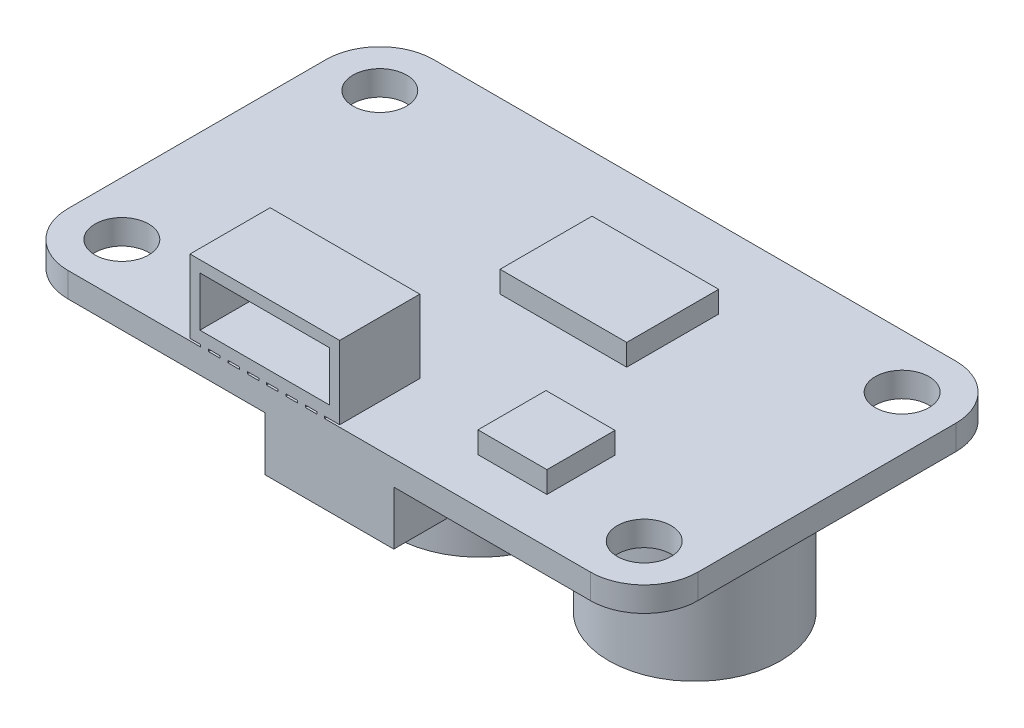
from build123d import *

# Parameters (mm, degrees)
SKETCH1_W           = 29.3
SKETCH1_H           = 17
SKETCH1_R           = 1.25
BOSS_EXTRUDE1_DEPTH = 1.15
FILLET1_R           = 2.5
SKETCH2_W           = 6.962283529
SKETCH2_H           = 3.729158124
BOSS_EXTRUDE2_DEPTH = 3.5
SKETCH3_W           = 0.499386372
SKETCH3_H           = 0.1
SKETCH3_W_2         = 0.535571303
SKETCH3_W_3         = 0.69846846
CUT_EXTRUDE1_DEPTH  = 5.5
SKETCH4_W           = 6.01860052
SKETCH4_H           = 2.306780687
CUT_EXTRUDE2_DEPTH  = 3.5
SKETCH5_W           = 5.89277612
SKETCH5_H           = 4.278029639
BOSS_EXTRUDE3_DEPTH = 1
SKETCH6_W           = 3.208522229
SKETCH6_H           = 3.166580762
BOSS_EXTRUDE4_DEPTH = 1
SKETCH7_W           = 6
SKETCH7_H           = 6
BOSS_EXTRUDE5_DEPTH = 3
SKETCH8_W           = 6
SKETCH8_H           = 6
SKETCH8_R           = 1.858011724
SKETCH8_R_2         = 0.603796911
CUT_EXTRUDE3_DEPTH  = 0.5
SKETCH10_R          = 4
BOSS_EXTRUDE6_DEPTH = 10
SKETCH11_R          = 2.5
CUT_EXTRUDE4_DEPTH  = 2
SKETCH12_R          = 2.5
SKETCH12_R_2        = 2.4
CUT_EXTRUDE5_DEPTH  = 2
FILLET2_R           = 2
SKETCH13_R          = 2.5
SKETCH13_R_2        = 2.4
CUT_EXTRUDE6_DEPTH  = 2
FILLET3_R           = 2
CHAMFER1_SIZE       = 0.5
SKETCH14_R          = 3.6
SKETCH14_R_2        = 3.5
CUT_EXTRUDE7_DEPTH  = 2


with BuildPart() as part:
    # Sketch1 → Boss-Extrude1 (new body)
    with BuildSketch(Plane(origin=(0, 0, 0), x_dir=(1, 0, 0), z_dir=(0, 1, 0))):
        Rectangle(SKETCH1_W, SKETCH1_H)
        with Locations(Location((-12.15, 6, 0), (0, 0, 270))):
            Circle(SKETCH1_R, mode=Mode.SUBTRACT)
        with Locations(Location((-12.15, -6, 0), (0, 0, 270))):
            Circle(SKETCH1_R, mode=Mode.SUBTRACT)
        with Locations(Location((12.15, -6, 0), (0, 0, 270))):
            Circle(SKETCH1_R, mode=Mode.SUBTRACT)
        with Locations(Location((12.15, 6, 0), (0, 0, 270))):
            Circle(SKETCH1_R, mode=Mode.SUBTRACT)
    extrude(amount=BOSS_EXTRUDE1_DEPTH)

    # Fillet1
    fillet1_edges = [part.edges().sort_by_distance(p)[0] for p in [
        (14.65, 0.575, 8.5),
        (-14.65, 0.575, 8.5),
        (-14.65, 0.575, -8.5),
        (14.65, 0.575, -8.5),
    ]]
    fillet(fillet1_edges, radius=FILLET1_R)

    # Sketch2 → Boss-Extrude2 (add)
    with BuildSketch(Plane(origin=(0, 1.15, 0), x_dir=(1, 0, 0), z_dir=(0, 1, 0))):
        with Locations((-2.998814894, -6.635420938)):
            Rectangle(SKETCH2_W, SKETCH2_H)
    extrude(amount=BOSS_EXTRUDE2_DEPTH)

    # Sketch3 → Cut-Extrude1 (cut)
    with BuildSketch(Plane.XY.offset(8.5)):
        with Locations((-6.230263472, 1.2)):
            Rectangle(SKETCH3_W, SKETCH3_H)
        with Locations((-5.348355938, 1.2)):
            Rectangle(SKETCH3_W_2, SKETCH3_H)
        with Locations((-4.448355938, 1.2)):
            Rectangle(SKETCH3_W_2, SKETCH3_H)
        with Locations((-3.548355938, 1.2)):
            Rectangle(SKETCH3_W_2, SKETCH3_H)
        with Locations((-2.648355937, 1.2)):
            Rectangle(SKETCH3_W_2, SKETCH3_H)
        with Locations((-1.748355937, 1.2)):
            Rectangle(SKETCH3_W_2, SKETCH3_H)
        with Locations((-0.848355938, 1.2)):
            Rectangle(SKETCH3_W_2, SKETCH3_H)
        with Locations((0.133092641, 1.2)):
            Rectangle(SKETCH3_W_3, SKETCH3_H)
    extrude(amount=-CUT_EXTRUDE1_DEPTH, mode=Mode.SUBTRACT)

    # Sketch4 → Cut-Extrude2 (cut)
    with BuildSketch(Plane.XY.offset(8.5)):
        with Locations((-3.00930026, 2.964607373)):
            Rectangle(SKETCH4_W, SKETCH4_H)
    extrude(amount=-CUT_EXTRUDE2_DEPTH, mode=Mode.SUBTRACT)

    # Sketch5 → Boss-Extrude3 (add)
    with BuildSketch(Plane(origin=(0, 1.15, 0), x_dir=(1, 0, 0), z_dir=(0, 1, 0))):
        with Locations((1.792997716, 2.736680725)):
            Rectangle(SKETCH5_W, SKETCH5_H)
    extrude(amount=BOSS_EXTRUDE3_DEPTH)

    # Sketch6 → Boss-Extrude4 (add)
    with BuildSketch(Plane(origin=(0, 1.15, 0), x_dir=(1, 0, 0), z_dir=(0, 1, 0))):
        with Locations((6.406559091, -4.802297976)):
            Rectangle(SKETCH6_W, SKETCH6_H)
    extrude(amount=BOSS_EXTRUDE4_DEPTH)

    # Sketch7 → Boss-Extrude5 (add)
    with BuildSketch(Plane.XZ):
        with Locations((0, 5.5)):
            Rectangle(SKETCH7_W, SKETCH7_H)
    extrude(amount=BOSS_EXTRUDE5_DEPTH)

    # Sketch8 → Cut-Extrude3 (cut)
    # profile 1 of 2: a face of its own
    with BuildSketch(Plane.XZ.offset(3)):
        with Locations((0, 5.5)):
            Rectangle(SKETCH8_W, SKETCH8_H)
        with Locations(Location((0, 5.56772975, 0), (0, 0, 270))):
            Circle(SKETCH8_R, mode=Mode.SUBTRACT)
    # profile 2 of 2: a face of its own
    with BuildSketch(Plane.XZ.offset(3)):
        with Locations(Location((0, 5.56772975, 0), (0, 0, 270))):
            Circle(SKETCH8_R_2)
    extrude(amount=-CUT_EXTRUDE3_DEPTH, mode=Mode.SUBTRACT)

    # Sketch10 → Boss-Extrude6 (add)
    with BuildSketch(Plane.XZ):
        with Locations(Location((5, -3.5, 0), (0, 0, 90))):
            Circle(SKETCH10_R)
        with Locations(Location((-5, -3.5, 0), (0, 0, 90))):
            Circle(SKETCH10_R)
    extrude(amount=BOSS_EXTRUDE6_DEPTH)

    # Sketch11 → Cut-Extrude4 (cut)
    with BuildSketch(Plane.XZ.offset(10)):
        with Locations(Location((-5, -3.5, 0), (0, 0, 270))):
            Circle(SKETCH11_R)
        with Locations(Location((5, -3.5, 0), (0, 0, 270))):
            Circle(SKETCH11_R)
    extrude(amount=-CUT_EXTRUDE4_DEPTH, mode=Mode.SUBTRACT)

    # Sketch12 → Cut-Extrude5 (cut)
    with BuildSketch(Plane.XZ.offset(8)):
        with Locations(Location((-5, -3.5, 0), (0, 0, 270))):
            Circle(SKETCH12_R)
        with Locations(Location((-5, -3.5, 0), (0, 0, 270))):
            Circle(SKETCH12_R_2, mode=Mode.SUBTRACT)
    extrude(amount=-CUT_EXTRUDE5_DEPTH, mode=Mode.SUBTRACT)

    # Fillet2
    fillet2_edges = [part.edges().sort_by_distance(p)[0] for p in [
        (-5, -8, -1.1),
    ]]
    fillet(fillet2_edges, radius=FILLET2_R - 0.0001)  # a hair under: the kernel refuses the full size

    # Sketch13 → Cut-Extrude6 (cut)
    with BuildSketch(Plane.XZ.offset(8)):
        with Locations(Location((5, -3.5, 0), (0, 0, 270))):
            Circle(SKETCH13_R)
        with Locations(Location((5, -3.5, 0), (0, 0, 270))):
            Circle(SKETCH13_R_2, mode=Mode.SUBTRACT)
    extrude(amount=-CUT_EXTRUDE6_DEPTH, mode=Mode.SUBTRACT)

    # Fillet3
    fillet3_edges = [part.edges().sort_by_distance(p)[0] for p in [
        (5, -8, -1.1),
    ]]
    fillet(fillet3_edges, radius=FILLET3_R - 0.0001)  # a hair under: the kernel refuses the full size

    # Chamfer1
    chamfer1_edges = [part.edges().sort_by_distance(p)[0] for p in [
        (5, 0, -7.5),
        (-5, 0, -7.5),
    ]]
    chamfer(chamfer1_edges, length=CHAMFER1_SIZE)

    # Sketch14 → Cut-Extrude7 (cut)
    # profile 1 of 2: a face of its own
    with BuildSketch(Plane.XZ.offset(10)):
        with Locations(Location((-5, -3.5, 0), (0, 0, 270))):
            Circle(SKETCH14_R)
        with Locations(Location((-5, -3.5, 0), (0, 0, 270))):
            Circle(SKETCH14_R_2, mode=Mode.SUBTRACT)
    # profile 2 of 2: a face of its own
    with BuildSketch(Plane.XZ.offset(10)):
        with Locations(Location((5, -3.5, 0), (0, 0, 270))):
            Circle(SKETCH14_R)
        with Locations(Location((5, -3.5, 0), (0, 0, 270))):
            Circle(SKETCH14_R_2, mode=Mode.SUBTRACT)
    extrude(amount=-CUT_EXTRUDE7_DEPTH, mode=Mode.SUBTRACT)


solid = part.part
